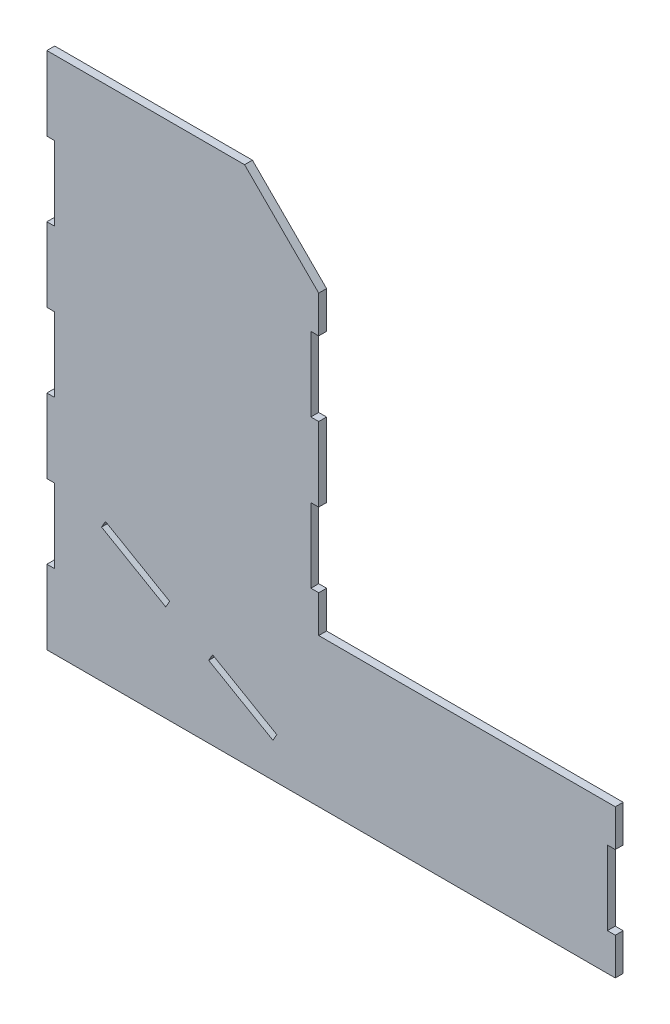
from build123d import *

# Parameters (mm, degrees)
BOSS_EXTRUDE1_DEPTH          = 1.5875
CUT_EXTRUDE_THIN1_DEPTH      = 199.424730891
CUT_EXTRUDE_THIN1_DEPTH_BACK = 199.424730891
SKETCH1_3_W                  = 3.18
SKETCH1_3_H                  = 30


with BuildPart() as part:
    # Sketch1 → Boss-Extrude1 (new, symmetric)
    with BuildSketch(Plane.XY):
        Polygon((-13.914893617, 144.397705985), (-93.914893617, 144.397705985), (-93.914893617, -65.602294015), (136.085106383, -65.602294015), (136.085106383, -5.602294015), (16.085106383, -5.602294015), (16.085106383, 114.397705985), align=None)
    extrude(amount=BOSS_EXTRUDE1_DEPTH, both=True)

    # Sketch1<3> → Cut-Extrude-Thin1 (cut, two sides: drawn at the far end of the back side and taken through both)
    with BuildSketch(Plane.XY.offset(-CUT_EXTRUDE_THIN1_DEPTH_BACK)):
        with Locations((-92.327393617, 99.397705985)):
            Rectangle(SKETCH1_3_W, SKETCH1_3_H)
        with Locations((-92.327393617, 39.397705985)):
            Rectangle(SKETCH1_3_W, SKETCH1_3_H)
        with Locations((-92.327393617, -20.602294015)):
            Rectangle(SKETCH1_3_W, SKETCH1_3_H)
        with Locations((14.497606383, 84.397705985)):
            Rectangle(SKETCH1_3_W, SKETCH1_3_H)
        with Locations((14.497606383, 24.397705985)):
            Rectangle(SKETCH1_3_W, SKETCH1_3_H)
        with Locations((134.497606383, -35.602294015)):
            Rectangle(SKETCH1_3_W, SKETCH1_3_H)
        Polygon((-71.7928283, -11.526918626), (-45.812066186, -26.526918626), (-44.222066186, -23.772957842), (-70.2028283, -8.772957842), align=None)
        Polygon((-0.861958934, -48.806927436), (-26.842721048, -33.806927436), (-28.432721048, -36.56088822), (-2.451958934, -51.56088822), align=None)
    extrude(amount=CUT_EXTRUDE_THIN1_DEPTH + CUT_EXTRUDE_THIN1_DEPTH_BACK, mode=Mode.SUBTRACT)


solid = part.part
